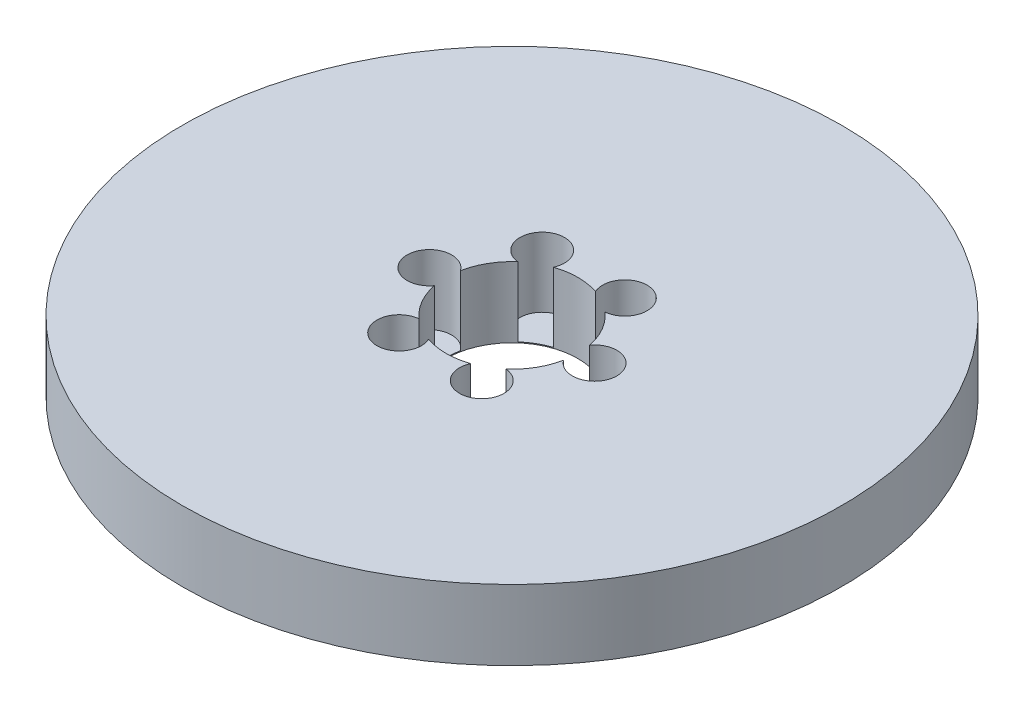
from build123d import *

# Parameters (mm, degrees)
SKETCH1_R           = 37.5
BOSS_EXTRUDE1_DEPTH = 8
SKETCH2_R           = 7.5
CUT_EXTRUDE1_DEPTH  = 54.633012222
SKETCH3_R           = 2.532319178
CUT_EXTRUDE2_DEPTH  = 7.896978043
CIRPATTERN1_COUNT   = 6


with BuildPart() as part:
    # Sketch1 → Boss-Extrude1 (new body)
    with BuildSketch(Plane(origin=(0, 0, 0), x_dir=(1, 0, 0), z_dir=(0, 1, 0))):
        Circle(SKETCH1_R)
    extrude(amount=BOSS_EXTRUDE1_DEPTH)

    # Sketch2 → Cut-Extrude1 (cut, through all)
    with BuildSketch(Plane(origin=(0, 0, 0), x_dir=(1, 0, 0), z_dir=(0, 1, 0))):
        Circle(SKETCH2_R)
    extrude(amount=CUT_EXTRUDE1_DEPTH, mode=Mode.SUBTRACT)

    # Sketch3 → Cut-Extrude2 (cut)
    with BuildSketch(Plane(origin=(0, 8, 0), x_dir=(1, 0, 0), z_dir=(0, 1, 0))):
        with Locations((-9.3993324, 0)):
            Circle(SKETCH3_R)
    cut_extrude2 = extrude(amount=-CUT_EXTRUDE2_DEPTH, mode=Mode.SUBTRACT)

    # CirPattern1: Cut-Extrude2 ×6 about axis
    cirpattern1_axis = Axis((0, 0, 0), (0, 1, 0))
    for i in range(1, CIRPATTERN1_COUNT):
        add(cut_extrude2.rotate(cirpattern1_axis, i * 360 / CIRPATTERN1_COUNT), mode=Mode.SUBTRACT)


solid = part.part
